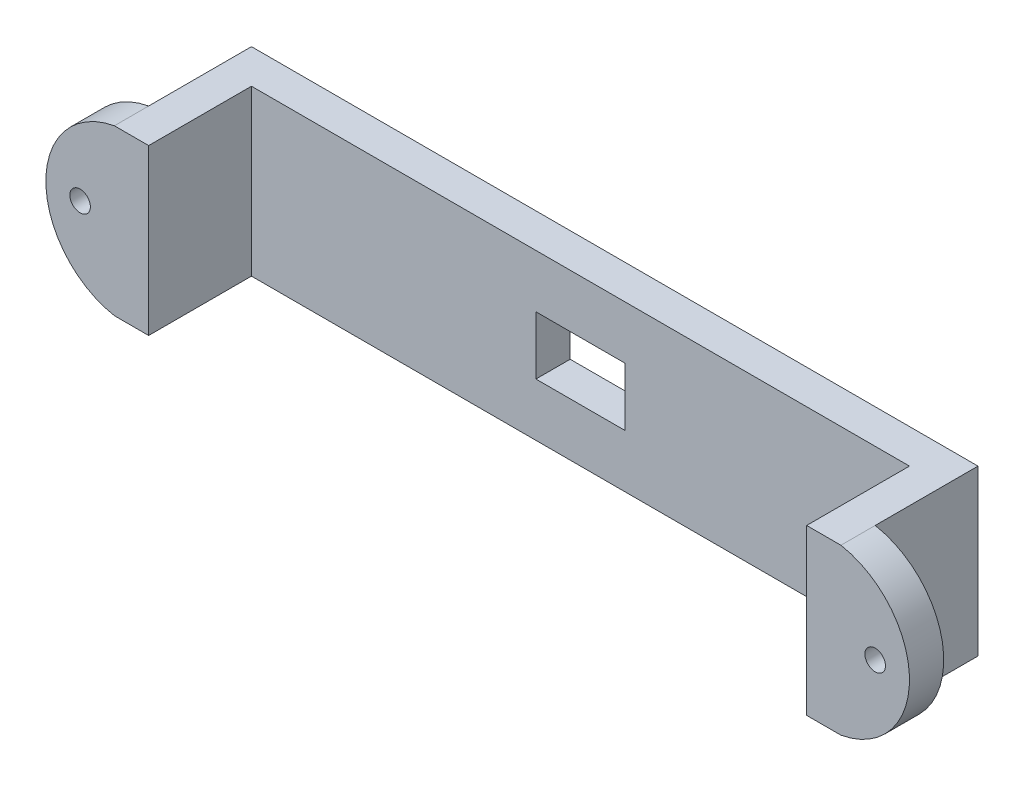
from build123d import *

# Parameters (mm, degrees)
ESQUISSE1_W             = 106
ESQUISSE1_H             = 24
ESQUISSE1_W_2           = 13
ESQUISSE1_H_2           = 8.5
BOSS_EXTRU_1_DEPTH      = 5
ESQUISSE2_W             = 5
ESQUISSE2_H             = 24
BOSS_EXTRU_2_DEPTH      = 10
BOSS_EXTRU_3_DEPTH      = 5
ESQUISSE4_R             = 1.5
ENL_V_MAT_EXTRU_2_DEPTH = 68.178865724


with BuildPart() as part:
    # Esquisse1 → Boss.-Extru.1 (new body)
    with BuildSketch(Plane.XY):
        Rectangle(ESQUISSE1_W, ESQUISSE1_H)
        Rectangle(ESQUISSE1_W_2, ESQUISSE1_H_2, mode=Mode.SUBTRACT)
    extrude(amount=BOSS_EXTRU_1_DEPTH)

    # Esquisse2 → Boss.-Extru.2 (add)
    with BuildSketch(Plane.XY.offset(5)):
        with Locations((-50.5, 0)):
            Rectangle(ESQUISSE2_W, ESQUISSE2_H)
        with Locations((50.5, 0)):
            Rectangle(ESQUISSE2_W, ESQUISSE2_H)
    extrude(amount=BOSS_EXTRU_2_DEPTH)

    # Esquisse3 → Boss.-Extru.3 (add)
    with BuildSketch(Plane.XY.offset(15)):
        with BuildLine():
            Line((-48, 12), (-53, 12))
            ThreePointArc((-53, 12), (-63, 0), (-53, -12))
            Line((-53, -12), (-48, -12))
            Line((-48, -12), (-48, 12))
        make_face()
        with BuildLine():
            Line((48, -12), (53, -12))
            ThreePointArc((53, -12), (63, 0), (53, 12))
            Line((53, 12), (48, 12))
            Line((48, 12), (48, -12))
        make_face()
    extrude(amount=BOSS_EXTRU_3_DEPTH)

    # Esquisse4 → Enlèv. mat.-Extru.2 (cut, through all)
    with BuildSketch(Plane.XY.offset(20)):
        with Locations((-58, 0)):
            Circle(ESQUISSE4_R)
        with Locations((58, 0)):
            Circle(ESQUISSE4_R)
    extrude(amount=-ENL_V_MAT_EXTRU_2_DEPTH, mode=Mode.SUBTRACT)


solid = part.part
